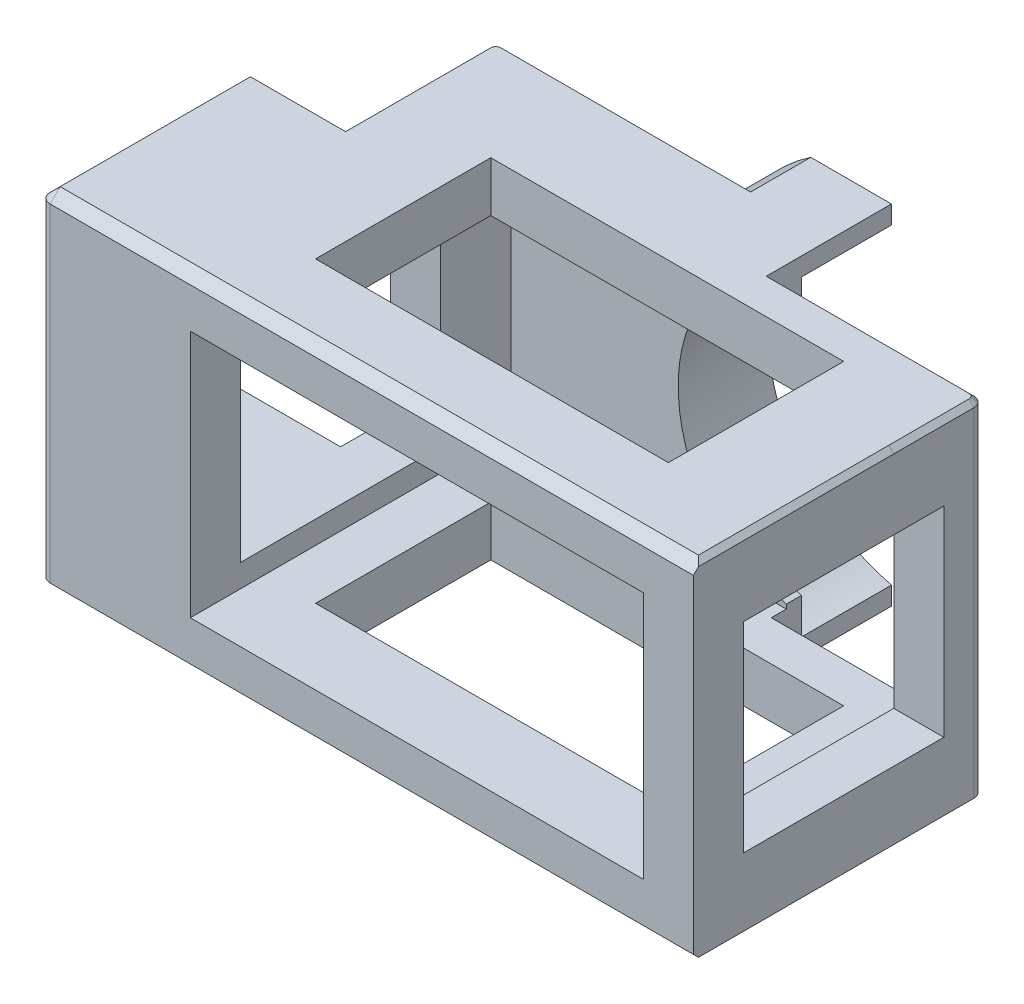
from build123d import *

# Parameters (mm, degrees)
SKETCH_1_W              = 45.23
SKETCH_1_H              = 24.78
EXTRUDE_1_DEPTH         = 35
CUT_EXTRUDE_1_DEPTH     = 3
SKETCH_5_W              = 1.897849624
SKETCH_5_H              = 24.78
CUT_EXTRUDE_3_DEPTH     = 3
EXTRUDE_2_DEPTH         = 17.9
EXTRUDE_2_DEPTH_BACK    = 18.6
EXTRUDE_2_START         = 17.5
SKETCH_3_R              = 3
SKETCH_4_W              = 30.897849624
SKETCH_4_H              = 5
CUT_EXTRUDE_2_DEPTH     = 1.5
SKETCH_6_W              = 10
SKETCH_6_H              = 18
CUT_EXTRUDE_4_DEPTH     = 1.5
SHELL_START             = -5
SHELL_12_DEPTH          = 5
SHELL_START_2           = 45.23
SHELL_12_2_OUTLINE_W    = 34.78
SHELL_12_2_OUTLINE_H    = 39
SHELL_12_2_DEPTH        = 5
SHELL_12_3_OUTLINE_W    = 34.78
SHELL_12_3_OUTLINE_H    = 1.5
SHELL_12_3_DEPTH        = 34
SHELL_12_4_OUTLINE_W    = 28
SHELL_12_4_OUTLINE_H    = 1.5
SHELL_12_4_DEPTH        = 20
SHELL_12_5_OUTLINE_W    = 45.23
SHELL_12_5_OUTLINE_H    = 39
SHELL_12_5_DEPTH        = 34.78
SHELL_START_3           = 3
SHELL_12_6_OUTLINE_W    = 45.23
SHELL_12_6_OUTLINE_H    = 24.78
SHELL_12_6_DEPTH        = 29
SHELL_START_4           = 1.5
SHELL_12_7_OUTLINE_R    = 3
SHELL_12_7_DEPTH        = 32
SHELL_12_8_OUTLINE_R    = 3
SHELL_12_8_OUTLINE_W    = 10
SHELL_12_8_OUTLINE_H    = 14.78
SHELL_12_8_DEPTH        = 35
SHELL_12_9_OUTLINE_W    = 5
SHELL_12_9_OUTLINE_H    = 14.78
SHELL_12_9_DEPTH        = 1.5
SHELL_START_5           = 33.5
SHELL_12_10_OUTLINE_W   = 10
SHELL_12_10_OUTLINE_H   = 1.585
SHELL_12_10_OUTLINE_H_2 = 1.635
SHELL_12_10_DEPTH       = 1.5
SHELL_START_6           = -1.1
SHELL_12_11_OUTLINE_R   = 3
SHELL_12_11_DEPTH       = 36.5
SHELL_START_7           = 37
SHELL_12_12_OUTLINE_R   = 8
SHELL_12_12_DEPTH       = 3.4
SHELL_START_8           = -6.1
SHELL_12_13_OUTLINE_R   = 8
SHELL_12_13_DEPTH       = 4.1
CUT_EXTRUDE_7_DEPTH     = 70.724538722
CUT_EXTRUDE_8_DEPTH     = 70.724538722
CUT_EXTRUDE_9_REACH     = 70.969
SKETCH_14_W             = 35.23
SKETCH_14_H             = 17.5
CUT_EXTRUDE_10_REACH    = 72.436
SKETCH_15_W             = 20
SKETCH_15_H             = 20
SKETCH_16_W             = 5
SKETCH_16_H             = 1.5
CUT_EXTRUDE_11_DEPTH    = 34.78
CUT_EXTRUDE_12_REACH    = 72.436
SKETCH_17_W             = 5
SKETCH_17_H             = 34.78
SKETCH_19_W             = 34
SKETCH_19_H             = 1.5
CUT_EXTRUDE_14_DEPTH    = 24.78
FILLET_3_R              = 1
EXTRUDE_3_DEPTH         = 10
EXTRUDE_4_DEPTH         = 10
FILLET_4_R              = 1
CHAMFER_3_SIZE          = 1
CHAMFER_4_SIZE          = 0.5
CUT_EXTRUDE_15_DEPTH    = 10
CHAMFER_5_SIZE          = 0.5
CUT_EXTRUDE_START       = -3.5
CUT_EXTRUDE_16_DEPTH    = 3.5
EXTRUDE_5_DEPTH         = 5.5
EXTRUDE_5_DEPTH_BACK    = 1


with BuildPart() as part:
    # 草图1 → 凸台-拉伸1 (new body)
    with BuildSketch(Plane.XY):
        with Locations((22.615, 12.39)):
            Rectangle(SKETCH_1_W, SKETCH_1_H)
    extrude(amount=EXTRUDE_1_DEPTH)

    # 草图2 → 切除-拉伸1 (cut)
    with BuildSketch(Plane.XY):
        with BuildLine():
            Line((45.23, 24.78), (30.897849624, 24.78))
            ThreePointArc((30.897849624, 24.78), (20.186819111, 12.39), (30.897849624, 0))
            Line((30.897849624, 0), (45.23, 0))
            Line((45.23, 0), (45.23, 24.78))
        make_face()
    cut_extrude_1 = extrude(amount=CUT_EXTRUDE_1_DEPTH, mode=Mode.SUBTRACT)

    # 草图5 → 切除-拉伸3 (cut)
    with BuildSketch(Plane.XY):
        with Locations((29.948924812, 12.39)):
            Rectangle(SKETCH_5_W, SKETCH_5_H)
    cut_extrude_3 = extrude(amount=CUT_EXTRUDE_3_DEPTH, mode=Mode.SUBTRACT)

    # 镜向1: 切除-拉伸1, 切除-拉伸3 across plane
    add(cut_extrude_1.mirror(Plane.XY.offset(17.5)), mode=Mode.SUBTRACT)
    add(cut_extrude_3.mirror(Plane.XY.offset(17.5)), mode=Mode.SUBTRACT)

    # 草图3 → 凸台-拉伸2 (add, two sides: drawn at the far end of the back side and taken through both)
    with BuildSketch(Plane.XY.offset(EXTRUDE_2_START - EXTRUDE_2_DEPTH_BACK)):
        with Locations((32.708409555, 12.39)):
            Circle(SKETCH_3_R)
    extrude(amount=EXTRUDE_2_DEPTH + EXTRUDE_2_DEPTH_BACK)

    # 草图4 → 切除-拉伸2 (cut)
    with BuildSketch(Plane.XY):
        with Locations((15.448924812, 22.28)):
            Rectangle(SKETCH_4_W, SKETCH_4_H)
        with Locations((15.448924812, 2.5)):
            Rectangle(SKETCH_4_W, SKETCH_4_H)
    extrude(amount=CUT_EXTRUDE_2_DEPTH, mode=Mode.SUBTRACT)

    # 草图6 → 切除-拉伸4 (cut)
    with BuildSketch(Plane.XY.offset(35)):
        with BuildLine():
            Line((29, 24.78), (0, 24.78))
            Line((0, 24.78), (0, 0))
            Line((0, 0), (29, 0))
            Line((29, 0), (29, 0.430153603))
            ThreePointArc((29, 0.430153603), (20.186819111, 12.39), (29, 24.349846397))
            Line((29, 24.349846397), (29, 24.78))
        make_face()
        with Locations((10, 12.365)):
            Rectangle(SKETCH_6_W, SKETCH_6_H, mode=Mode.SUBTRACT)
    extrude(amount=-CUT_EXTRUDE_4_DEPTH, mode=Mode.SUBTRACT)

    # 抽壳12: read off the stored shape, not the designer's step
    # 抽壳12 outline → 抽壳12 (add)
    with BuildSketch(Plane.YZ.offset(SHELL_START)):
        Polygon((0, -3.5), (0, -5), (24.78, -5), (24.78, -3.5), (29.78, -3.5), (29.78, 38.5), (-5, 38.5), (-5, -3.5), align=None)
    extrude(amount=SHELL_12_DEPTH)

    # Shell 12 2 outline → Shell 12 2 (add)
    with BuildSketch(Plane.YZ.offset(SHELL_START_2)):
        with Locations((12.39, 17.5)):
            Rectangle(SHELL_12_2_OUTLINE_W, SHELL_12_2_OUTLINE_H)
    extrude(amount=SHELL_12_2_DEPTH)

    # Shell 12 3 outline → Shell 12 3 (add)
    with BuildSketch(Plane.YZ):
        Polygon((0, -3.5), (0, -5), (24.78, -5), (24.78, -3.5), (29.78, -3.5), (29.78, -2), (-5, -2), (-5, -3.5), align=None)
        with Locations((12.39, 37.75)):
            Rectangle(SHELL_12_3_OUTLINE_W, SHELL_12_3_OUTLINE_H)
    extrude(amount=SHELL_12_3_DEPTH)

    # Shell 12 4 outline → Shell 12 4 (add)
    with BuildSketch(Plane.YZ):
        with Locations((12.365, 39.25)):
            Rectangle(SHELL_12_4_OUTLINE_W, SHELL_12_4_OUTLINE_H)
    extrude(amount=SHELL_12_4_DEPTH)

    # Shell 12 5 outline → Shell 12 5 (add)
    with BuildSketch(Plane(origin=(0, 0, 0), x_dir=(1, 0, 0), z_dir=(0, 1, 0)).offset(SHELL_START)):
        with Locations((22.615, -17.5)):
            Rectangle(SHELL_12_5_OUTLINE_W, SHELL_12_5_OUTLINE_H)
    extrude(amount=SHELL_12_5_DEPTH)

    # Shell 12 6 outline → Shell 12 6 (cut)
    with BuildSketch(Plane.XY.offset(SHELL_START_3)):
        with Locations((22.615, 12.39)):
            Rectangle(SHELL_12_6_OUTLINE_W, SHELL_12_6_OUTLINE_H)
    extrude(amount=SHELL_12_6_DEPTH, mode=Mode.SUBTRACT)

    # Shell 12 7 outline → Shell 12 7 (cut)
    with BuildSketch(Plane.XY.offset(SHELL_START_4)):
        with Locations((32.708409555, 12.39)):
            Circle(SHELL_12_7_OUTLINE_R)
        with BuildLine():
            Line((29, 24.349846397), (29, 24.78))
            Line((29, 24.78), (0, 24.78))
            Line((0, 24.78), (0, 0))
            Line((0, 0), (29, 0))
            Line((29, 0), (29, 0.430153603))
            ThreePointArc((29, 0.430153603), (20.186819111, 12.39), (29, 24.349846397))
        make_face()
    extrude(amount=SHELL_12_7_DEPTH, mode=Mode.SUBTRACT)

    # Shell 12 8 outline → Shell 12 8 (cut)
    with BuildSketch(Plane.XY):
        with Locations((32.708409555, 12.39)):
            Circle(SHELL_12_8_OUTLINE_R)
        with Locations((10, 12.39)):
            Rectangle(SHELL_12_8_OUTLINE_W, SHELL_12_8_OUTLINE_H)
    extrude(amount=SHELL_12_8_DEPTH, mode=Mode.SUBTRACT)

    # Shell 12 9 outline → Shell 12 9 (cut)
    with BuildSketch(Plane.XY):
        with Locations((2.5, 12.39)):
            Rectangle(SHELL_12_9_OUTLINE_W, SHELL_12_9_OUTLINE_H)
        with BuildLine():
            ThreePointArc((22.60008985, 5), (20.186819111, 12.39), (22.60008985, 19.78))
            Line((22.60008985, 19.78), (15, 19.78))
            Line((15, 19.78), (15, 5))
            Line((15, 5), (22.60008985, 5))
        make_face()
    extrude(amount=SHELL_12_9_DEPTH, mode=Mode.SUBTRACT)

    # Shell 12 10 outline → Shell 12 10 (cut)
    with BuildSketch(Plane.XY.offset(SHELL_START_5)):
        with Locations((10, 20.5725)):
            Rectangle(SHELL_12_10_OUTLINE_W, SHELL_12_10_OUTLINE_H)
        with Locations((10, 4.1825)):
            Rectangle(SHELL_12_10_OUTLINE_W, SHELL_12_10_OUTLINE_H_2)
    extrude(amount=SHELL_12_10_DEPTH, mode=Mode.SUBTRACT)

    # Shell 12 11 outline → Shell 12 11 (cut)
    with BuildSketch(Plane.XY.offset(SHELL_START_6)):
        with Locations((32.708409555, 12.39)):
            Circle(SHELL_12_11_OUTLINE_R)
    extrude(amount=SHELL_12_11_DEPTH, mode=Mode.SUBTRACT)

    # Shell 12 12 outline → Shell 12 12 (add)
    with BuildSketch(Plane.XY.offset(SHELL_START_7)):
        with Locations((32.708409555, 12.39)):
            Circle(SHELL_12_12_OUTLINE_R)
    extrude(amount=SHELL_12_12_DEPTH)

    # Shell 12 13 outline → Shell 12 13 (add)
    with BuildSketch(Plane.XY.offset(SHELL_START_8)):
        with Locations((32.708409555, 12.39)):
            Circle(SHELL_12_13_OUTLINE_R)
    extrude(amount=SHELL_12_13_DEPTH)

    # 草图12 → 切除-拉伸7 (cut, through all)
    with BuildSketch(Plane(origin=(0, 0, 32), x_dir=(-1, 0, 0), z_dir=(0, 0, -1))):
        Polygon((-50.23, 29.78), (-50.23, -5), (-34, -5), (5, -5), (5, 29.78), (-34, 29.78), align=None)
    extrude(amount=-CUT_EXTRUDE_7_DEPTH, mode=Mode.SUBTRACT)

    # 草图13 → 切除-拉伸8 (cut, through all)
    with BuildSketch(Plane(origin=(0, 0, 32), x_dir=(-1, 0, 0), z_dir=(0, 0, -1))):
        with BuildLine():
            Line((-45.23, 0), (-29, 0))
            Line((-29, 0), (-29, 0.430153603))
            ThreePointArc((-29, 0.430153603), (-20.186819111, 12.39), (-29, 24.349846397))
            Line((-29, 24.349846397), (-29, 24.78))
            Line((-29, 24.78), (-45.23, 24.78))
            Line((-45.23, 24.78), (-45.23, 0))
        make_face()
    extrude(amount=CUT_EXTRUDE_8_DEPTH, mode=Mode.SUBTRACT)

    # 切除-拉伸9: up to this face of the body (flat: up to its plane)
    cut_extrude_9_end = Plane(part.part.faces().sort_by_distance((22.369830038, 29.78, 14.463737915))[0])
    # 草图14 → 切除-拉伸9 (cut, up to the picked face)
    with BuildSketch(Plane.XZ.offset(5), mode=Mode.PRIVATE) as cut_extrude_9_sk1:
        with Locations((22.615, 15.75)):
            Rectangle(SKETCH_14_W, SKETCH_14_H)
    cut_extrude_9_tool1 = split(extrude(cut_extrude_9_sk1.sketch, amount=-CUT_EXTRUDE_9_REACH, mode=Mode.PRIVATE), bisect_by=cut_extrude_9_end, keep=Keep.BOTH, mode=Mode.PRIVATE)
    add(cut_extrude_9_tool1.solids().sort_by(Axis((22.615, -5, 15.75), (0, 1, 0)))[0], mode=Mode.SUBTRACT)

    # 切除-拉伸10: up to this face of the body (flat: up to its plane)
    cut_extrude_10_end = Plane(part.part.faces().sort_by_distance((-5, 12.39, 13.709339078))[0])
    # 草图15 → 切除-拉伸10 (cut, up to the picked face)
    with BuildSketch(Plane(origin=(50.23, 0, 0), x_dir=(0, 0, -1), z_dir=(1, 0, 0)), mode=Mode.PRIVATE) as cut_extrude_10_sk1:
        with Locations((-17, 12.28)):
            Rectangle(SKETCH_15_W, SKETCH_15_H)
    cut_extrude_10_tool1 = split(extrude(cut_extrude_10_sk1.sketch, amount=-CUT_EXTRUDE_10_REACH, mode=Mode.PRIVATE), bisect_by=cut_extrude_10_end, keep=Keep.BOTH, mode=Mode.PRIVATE)
    add(cut_extrude_10_tool1.solids().sort_by(Axis((50.23, 12.28, 17), (-1, 0, 0)))[0], mode=Mode.SUBTRACT)

    # 草图16 → 切除-拉伸11 (cut)
    with BuildSketch(Plane.XZ.offset(5)):
        with Locations((31.5, -2.75)):
            Rectangle(SKETCH_16_W, SKETCH_16_H)
    extrude(amount=-CUT_EXTRUDE_11_DEPTH, mode=Mode.SUBTRACT)

    # 切除-拉伸12: up to this face of the body (flat: up to its plane)
    cut_extrude_12_end = Plane(part.part.faces().sort_by_distance((29, -1.762689237, -2.47843834))[0])
    # 草图17 → 切除-拉伸12 (cut, up to the picked face)
    with BuildSketch(Plane(origin=(50.23, 0, 0), x_dir=(0, 0, -1), z_dir=(1, 0, 0)), mode=Mode.PRIVATE) as cut_extrude_12_sk1:
        with Locations((-0.5, 12.39)):
            Rectangle(SKETCH_17_W, SKETCH_17_H)
    cut_extrude_12_tool1 = split(extrude(cut_extrude_12_sk1.sketch, amount=-CUT_EXTRUDE_12_REACH, mode=Mode.PRIVATE), bisect_by=cut_extrude_12_end, keep=Keep.BOTH, mode=Mode.PRIVATE)
    add(cut_extrude_12_tool1.solids().sort_by(Axis((50.23, 12.39, 0.5), (-1, 0, 0)))[0], mode=Mode.SUBTRACT)

    # 草图19 → 切除-拉伸14 (cut)
    with BuildSketch(Plane(origin=(0, 24.78, 0), x_dir=(1, 0, 0), z_dir=(0, 1, 0))):
        with Locations((12, 4.25)):
            Rectangle(SKETCH_19_W, SKETCH_19_H)
    extrude(amount=-CUT_EXTRUDE_14_DEPTH, mode=Mode.SUBTRACT)

    # 圆角3
    fillet_3_edges = [part.edges().sort_by_distance(p)[0] for p in [
        (-5, 12.39, -3.5),
        (50.23, 12.39, 3),
    ]]
    fillet(fillet_3_edges, radius=FILLET_3_R)

    # 草图20 → 凸台-拉伸3 (add)
    with BuildSketch(Plane(origin=(50.23, 0, 0), x_dir=(0, 0, -1), z_dir=(1, 0, 0))):
        Polygon((-12, 22.28), (-12, 29.78), (-32, 29.78), (-32, -5), (-12, -5), (-12, 2.28), (-27, 2.28), (-27, 22.28), align=None)
    extrude(amount=EXTRUDE_3_DEPTH)

    # 草图22 → 凸台-拉伸4 (add)
    with BuildSketch(Plane.ZY.offset(5)):
        Polygon((32, 29.78), (12, 29.78), (12, 22.28), (27, 22.28), (27, 2.28), (12, 2.28), (12, -5), (32, -5), align=None)
    extrude(amount=EXTRUDE_4_DEPTH)

    # 圆角4
    fillet_4_edges = [part.edges().sort_by_distance(p)[0] for p in [
        (60.23, 12.39, 32),
        (-15, 12.39, 32),
    ]]
    fillet(fillet_4_edges, radius=FILLET_4_R)

    # 倒角3
    chamfer_3_edges = [part.edges().sort_by_distance(p)[0] for p in [
        (60.23, 29.78, 21.5),
        (-15, -5, 21.5),
        (-15, 29.78, 21.5),
        (22.615, 29.78, 32),
        (22.615, -5, 32),
        (60.23, -5, 21.5),
    ]]
    chamfer(chamfer_3_edges, length=CHAMFER_3_SIZE - 0.0001)  # a hair under: the kernel refuses the full size

    # 倒角4
    chamfer_4_edges = [part.edges().sort_by_distance(p)[0] for p in [
        (12.5, 29.78, -3.5),
        (39.115, -5, 3),
        (39.115, 29.78, 3),
        (12.5, -5, -3.5),
        (49.937106781, -5, 3.292893219),
        (-4.707106781, -5, -3.207106781),
        (49.937106781, 29.78, 3.292893219),
        (-4.707106781, 29.78, -3.207106781),
        (50.23, -5, 8),
        (50.23, 29.78, 8),
        (60.23, 12.28, 27),
        (-5, 29.78, 4.75),
        (-5, -5, 4.75),
        (-15, 12.28, 27),
    ]]
    chamfer(chamfer_4_edges, length=CHAMFER_4_SIZE)

    # 草图23 → 切除-拉伸15 (cut)
    with BuildSketch(Plane(origin=(50.23, 0, 0), x_dir=(0, 0, -1), z_dir=(1, 0, 0))):
        Polygon((-12, 29.78), (-32, 29.78), (-32, -5.874790902), (-12, -5.874790902), (-12, -4.5), (-12, 2.28), (-12, 22.28), (-12, 29.28), align=None)
    extrude(amount=CUT_EXTRUDE_15_DEPTH, mode=Mode.SUBTRACT)

    # 倒角5
    chamfer_5_edges = [part.edges().sort_by_distance(p)[0] for p in [
        (50.23, -5, 21.50005),
        (50.23, 29.78, 21.50005),
    ]]
    chamfer(chamfer_5_edges, length=CHAMFER_5_SIZE - 0.0001)  # a hair under: the kernel refuses the full size

    # 草图24 → 切除-拉伸16 (cut)
    with BuildSketch(Plane(origin=(0, 0, -3.5), x_dir=(-1, 0, 0), z_dir=(0, 0, -1)).offset(CUT_EXTRUDE_START)):
        with BuildLine():
            Line((-29, 27.954308484), (-29, 24.349846397))
            ThreePointArc((-29, 24.349846397), (-20.186819111, 12.39), (-29, 0.430153603))
            Line((-29, 0.430153603), (-29, -3.174308484))
            ThreePointArc((-29, -3.174308484), (-20.151846473, 2.473714226), (-16.708409555, 12.39))
            ThreePointArc((-16.708409555, 12.39), (-20.151846473, 22.306285774), (-29, 27.954308484))
        make_face()
    extrude(amount=CUT_EXTRUDE_16_DEPTH, mode=Mode.SUBTRACT)

    # 草图25 → 凸台-拉伸5 (add, two sides: drawn at the far end of the back side and taken through both)
    with BuildSketch(Plane(origin=(0, 0, -3.5), x_dir=(-1, 0, 0), z_dir=(0, 0, -1)).offset(-EXTRUDE_5_DEPTH_BACK)):
        with BuildLine():
            Line((-29, 27.954308484), (-29, 29.78))
            Line((-29, 29.78), (-20.936073339, 29.78))
            ThreePointArc((-20.936073339, 29.78), (-11.708409555, 12.39), (-20.936073339, -5))
            Line((-20.936073339, -5), (-29, -5))
            Line((-29, -5), (-29, -3.174308484))
            ThreePointArc((-29, -3.174308484), (-16.708409555, 12.39), (-29, 27.954308484))
        make_face()
    extrude(amount=EXTRUDE_5_DEPTH + EXTRUDE_5_DEPTH_BACK)


solid = part.part
